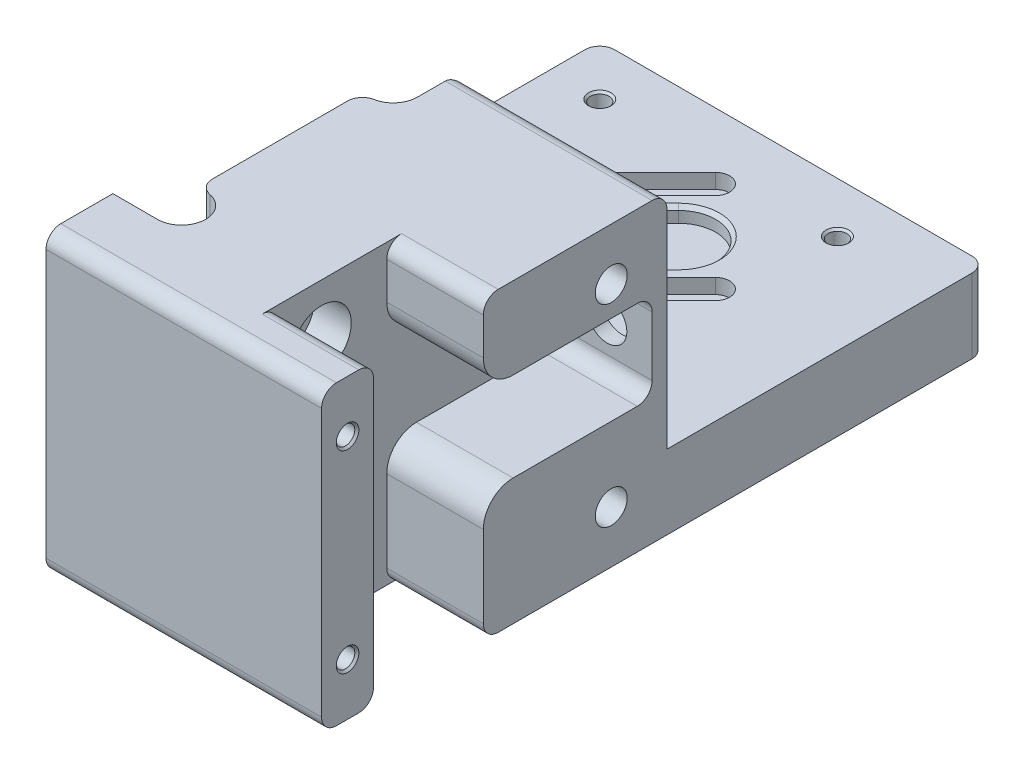
from build123d import *

# Parameters (mm, degrees)
SKETCH3_W                       = 13.49028586
SKETCH3_H                       = 10
BOSS_EXTRUDE1_DEPTH             = 22
SKETCH3_W_2                     = 3
BOSS_EXTRUDE1_2_DEPTH           = 22
BOSS_EXTRUDE1_3_DEPTH           = 22
SKETCH4_W                       = 27.150730292
SKETCH4_H                       = 10
BOSS_EXTRUDE2_DEPTH             = 3
SKETCH5_W                       = 27.150730292
SKETCH5_H                       = 10
BOSS_EXTRUDE3_DEPTH             = 3
SKETCH7_W                       = 13
SKETCH7_H                       = 14.78
BOSS_EXTRUDE4_DEPTH             = 10
BOSS_EXTRUDE5_DEPTH             = 10
SKETCH15_R                      = 1.915111108
CUT_EXTRUDE4_DEPTH              = 320.596652048
SKETCH18_W                      = 13
SKETCH18_H                      = 14.78
BOSS_EXTRUDE6_DEPTH             = 30
M4_CLEARANCE_HOLE1_D            = 4.3
CUT_EXTRUDE7_DEPTH              = 5
CUT_EXTRUDE6_DEPTH              = 2
M3X0_5_TAPPED_HOLE2_D           = 2.5
M3X0_5_TAPPED_HOLE2_CSINK_D     = 3.05
M3X0_5_TAPPED_HOLE2_CSINK_ANGLE = 90
SKETCH43_W                      = 32.1
SKETCH43_H                      = 30
BOSS_EXTRUDE9_DEPTH             = 2.5
SKETCH27_W                      = 22.72
SKETCH27_H                      = 12
CUT_EXTRUDE9_DEPTH              = 13
FILLET1_R                       = 2
FILLET2_R                       = 4
CBORE_FOR_M4_SHCS1_D            = 4.3
CBORE_FOR_M4_SHCS1_CBORE_D      = 8
CBORE_FOR_M4_SHCS1_CBORE_DEPTH  = 5
SKETCH31_W                      = 37.1
SKETCH31_H                      = 40
BOSS_EXTRUDE8_DEPTH             = 2
M3X0_5_TAPPED_HOLE3_D           = 2.5
M3X0_5_TAPPED_HOLE3_DEPTH       = 8.5
M3X0_5_TAPPED_HOLE3_CSINK_D     = 3.05
M3X0_5_TAPPED_HOLE3_CSINK_ANGLE = 90
M3X0_5_TAPPED_HOLE3_TIP         = 0.751075774
FILLET4_R                       = 2
CUT_EXTRUDE10_REACH             = 325.465
CUT_EXTRUDE12_DEPTH             = 10
FILLET5_R                       = 2
M5_CLEARANCE_HOLE1_D            = 5.3
M5_CLEARANCE_HOLE1_DEPTH        = 2
BOSS_EXTRUDE10_START            = -8
BOSS_EXTRUDE10_DEPTH            = 8
CHAMFER1_SIZE                   = 0.5


with BuildPart() as part:
    # Sketch3 → Boss-Extrude1 (new body)
    with BuildSketch(Plane(origin=(-188.9, 0, 188.9), x_dir=(0.7071067811865475, 0, 0.7071067811865477), z_dir=(-0.7071067811865477, 0, 0.7071067811865475))):
        with Locations((0, -11.606969024)):
            Rectangle(SKETCH3_W, SKETCH3_H)
    extrude(amount=-BOSS_EXTRUDE1_DEPTH)



with BuildPart() as body_2:
    # Sketch3 → Boss-Extrude1 2 (new body)
    with BuildSketch(Plane(origin=(-188.9, 0, 188.9), x_dir=(0.7071067811865475, 0, 0.7071067811865477), z_dir=(-0.7071067811865477, 0, 0.7071067811865475))):
        with Locations((12.075365146, -11.606969024)):
            Rectangle(SKETCH3_W_2, SKETCH3_H)
    extrude(amount=-BOSS_EXTRUDE1_2_DEPTH)


with BuildPart() as body_3:
    # Sketch3 → Boss-Extrude1 3 (new body)
    with BuildSketch(Plane(origin=(-188.9, 0, 188.9), x_dir=(0.7071067811865475, 0, 0.7071067811865477), z_dir=(-0.7071067811865477, 0, 0.7071067811865475))):
        with Locations((-12.075365146, -11.606969024)):
            Rectangle(SKETCH3_W_2, SKETCH3_H)
    extrude(amount=-BOSS_EXTRUDE1_3_DEPTH)


with BuildPart() as part_1:
    add(part.part)

    add(body_2.part)  # Boss-Extrude2 merges body 2

    add(body_3.part)  # Boss-Extrude2 merges body 3
    # Sketch4 → Boss-Extrude2 (add)
    with BuildSketch(Plane(origin=(-188.9, 0, 188.9), x_dir=(0.7071067811865472, 0, 0.7071067811865479), z_dir=(-0.7071067811865479, 0, 0.7071067811865472))):
        with Locations((0, -11.606969024)):
            Rectangle(SKETCH4_W, SKETCH4_H)
    extrude(amount=BOSS_EXTRUDE2_DEPTH)

    # Sketch5 → Boss-Extrude3 (add)
    with BuildSketch(Plane(origin=(-173.343650814, 0, 173.343650814), x_dir=(-0.7071067811865472, 0, -0.7071067811865479), z_dir=(0.7071067811865479, 0, -0.7071067811865472))):
        with Locations((0, -11.606969024)):
            Rectangle(SKETCH5_W, SKETCH5_H)
    extrude(amount=BOSS_EXTRUDE3_DEPTH)

    # Sketch7 → Boss-Extrude4 (add)
    with BuildSketch(Plane(origin=(0, -6.606969024, 0), x_dir=(1, 0, 0), z_dir=(0, 1, 0))):
        Polygon((-183.9, -238.9), (-188.9, -238.9), (-188.9, -245.9), (-146.8, -245.9), (-146.8, -161.623097719), (-180.821563222, -161.623097719), (-161.623097719, -180.821563222), (-181.422087592, -200.620553095), (-200.620553095, -181.422087592), (-200.620553095, -203.9), (-183.9, -203.9), align=None)
        with Locations((-158.3, -233.51)):
            Rectangle(SKETCH7_W, SKETCH7_H, mode=Mode.SUBTRACT)
    extrude(amount=-BOSS_EXTRUDE4_DEPTH)

    # Sketch13 → Boss-Extrude5 (add)
    with BuildSketch(Plane(origin=(0, -6.606969024, 0), x_dir=(1, 0, 0), z_dir=(0, 1, 0))):
        Polygon((-203.9, -203.9), (-200.620553095, -203.9), (-200.620553095, -181.422087592), (-180.821563222, -161.623097719), (-146.8, -161.623097719), (-146.8, -158.343650814), (-203.9, -158.343650814), align=None)
    extrude(amount=-BOSS_EXTRUDE5_DEPTH)

    # Sketch15 → Cut-Extrude4 (cut, through all)
    with BuildSketch(Plane(origin=(0, -6.606969024, 0), x_dir=(1, 0, 0), z_dir=(0, 1, 0))):
        with Locations((-179.467375171, -167.219926457)):
            Circle(SKETCH15_R)
        with Locations((-167.219926457, -179.467375171)):
            Circle(SKETCH15_R)
        with Locations((-195.023724357, -182.776275643)):
            Circle(SKETCH15_R)
        with Locations((-182.776275643, -195.023724357)):
            Circle(SKETCH15_R)
    extrude(amount=-CUT_EXTRUDE4_DEPTH, mode=Mode.SUBTRACT)

    # Sketch18 → Boss-Extrude6 (add)
    with BuildSketch(Plane(origin=(0, -6.606969024, 0), x_dir=(1, 0, 0), z_dir=(0, 1, 0))):
        Polygon((-183.9, -203.9), (-146.8, -203.9), (-146.8, -245.9), (-188.9, -245.9), (-188.9, -238.9), (-183.9, -238.9), align=None)
        with Locations((-158.3, -233.51)):
            Rectangle(SKETCH18_W, SKETCH18_H, mode=Mode.SUBTRACT)
    extrude(amount=BOSS_EXTRUDE6_DEPTH)

    # M4 Clearance Hole1 (through all)
    with Locations(Plane(origin=(-146.8, 0, 0), x_dir=(0, 0, -1), z_dir=(1, 0, 0))):
        with Locations((-208.9, 16.393030976), (-208.9, -9.606969024)):
            Hole(M4_CLEARANCE_HOLE1_D / 2)

    # Sketch22 → Cut-Extrude7 (cut)
    with BuildSketch(Plane(origin=(-146.8, 0, 0), x_dir=(0, 0, -1), z_dir=(1, 0, 0))):
        Polygon((-245.9, 23.393030976), (-245.9, -16.606969024), (-158.343650814, -16.606969024), (-158.343650814, -6.606969024), (-203.9, -6.606969024), (-203.9, 23.393030976), align=None)
    extrude(amount=-CUT_EXTRUDE7_DEPTH, mode=Mode.SUBTRACT)

    # Sketch17 → Cut-Extrude6 (cut)
    with BuildSketch(Plane(origin=(0, -6.606969024, 0), x_dir=(1, 0, 0), z_dir=(0, 1, 0))):
        with BuildLine():
            Line((-189.960660172, -182.88959236), (-179.354058454, -172.282990642))
            ThreePointArc((-179.354058454, -172.282990642), (-172.282990642, -172.282990642), (-172.282990642, -179.354058454))
            Line((-172.282990642, -179.354058454), (-182.88959236, -189.960660172))
            ThreePointArc((-182.88959236, -189.960660172), (-189.960660172, -189.960660172), (-189.960660172, -182.88959236))
        make_face()
    extrude(amount=-CUT_EXTRUDE6_DEPTH, mode=Mode.SUBTRACT)

    # M3x0.5 Tapped Hole2 (through all)
    with Locations(Plane(origin=(0, -6.606969024, 0), x_dir=(1, 0, 0), z_dir=(0, 1, 0))):
        with Locations((-197.121825407, -165.121825407), (-165.121825407, -197.121825407), (-197.121825407, -197.121825407), (-165.121825407, -165.121825407)):
            CounterSinkHole(M3X0_5_TAPPED_HOLE2_D / 2, M3X0_5_TAPPED_HOLE2_CSINK_D / 2, counter_sink_angle=M3X0_5_TAPPED_HOLE2_CSINK_ANGLE)

    # Sketch43 → Boss-Extrude9 (add)
    with BuildSketch(Plane(origin=(0, 0, 203.9), x_dir=(-1, 0, 0), z_dir=(0, 0, -1))):
        with Locations((167.85, 8.393030976)):
            Rectangle(SKETCH43_W, SKETCH43_H)
    extrude(amount=BOSS_EXTRUDE9_DEPTH)

    # Sketch27 → Cut-Extrude9 (cut)
    with BuildSketch(Plane(origin=(-151.8, 0, 0), x_dir=(0, 0, -1), z_dir=(1, 0, 0))):
        with Locations((-214.76, 6.393030976)):
            Rectangle(SKETCH27_W, SKETCH27_H)
    extrude(amount=-CUT_EXTRUDE9_DEPTH, mode=Mode.SUBTRACT)

    # Fillet1
    fillet1_edges = [part_1.edges().sort_by_distance(p)[0] for p in [
        (-158.3, 0.393030976, 203.4),
        (-158.3, 12.393030976, 203.4),
    ]]
    fillet(fillet1_edges, radius=FILLET1_R)

    # Fillet2
    fillet2_edges = [part_1.edges().sort_by_distance(p)[0] for p in [
        (-158.3, 12.393030976, 226.12),
        (-158.3, 0.393030976, 226.12),
    ]]
    fillet(fillet2_edges, radius=FILLET2_R)

    # CBORE for M4 SHCS1 (through all)
    with Locations(Plane(origin=(-164.8, 0, 0), x_dir=(0, 0, -1), z_dir=(1, 0, 0))):
        with Locations((-234.9, 16.393030976), (-234.9, -9.606969024)):
            CounterBoreHole(CBORE_FOR_M4_SHCS1_D / 2, CBORE_FOR_M4_SHCS1_CBORE_D / 2, CBORE_FOR_M4_SHCS1_CBORE_DEPTH)

    # Sketch31 → Boss-Extrude8 (add)
    with BuildSketch(Plane.XY.offset(245.9)):
        with Locations((-170.35, 3.393030976)):
            Rectangle(SKETCH31_W, SKETCH31_H)
    extrude(amount=BOSS_EXTRUDE8_DEPTH)

    # M3x0.5 Tapped Hole3
    with Locations(Plane(origin=(-151.8, 0, 0), x_dir=(0, 0, -1), z_dir=(1, 0, 0))):
        with Locations((-244.4, 16.393030976), (-244.4, -9.606969024)):
            CounterSinkHole(M3X0_5_TAPPED_HOLE3_D / 2, M3X0_5_TAPPED_HOLE3_CSINK_D / 2, depth=M3X0_5_TAPPED_HOLE3_DEPTH, counter_sink_angle=M3X0_5_TAPPED_HOLE3_CSINK_ANGLE)
            with Locations((0, 0, -(M3X0_5_TAPPED_HOLE3_DEPTH + M3X0_5_TAPPED_HOLE3_TIP / 2))):  # 118° drill point
                Cone(0, M3X0_5_TAPPED_HOLE3_D / 2, M3X0_5_TAPPED_HOLE3_TIP, mode=Mode.SUBTRACT)

    # Fillet4
    fillet4_edges = [part_1.edges().sort_by_distance(p)[0] for p in [
        (-158.3, -16.606969024, 226.12),
        (-203.9, -11.606969024, 203.9),
        (-203.9, -11.606969024, 158.343650814),
        (-158.3, 23.393030976, 226.12),
        (-158.3, 23.393030976, 240.9),
        (-151.8, -11.606969024, 158.343650814),
        (-167.85, 23.393030976, 201.4),
        (-170.35, -16.606969024, 247.9),
        (-170.35, 23.393030976, 247.9),
        (-158.3, -16.606969024, 240.9),
    ]]
    fillet(fillet4_edges, radius=FILLET4_R)

    # Cut-Extrude10: up to this face of the body (flat: up to its plane)
    cut_extrude10_end = Plane(part_1.part.faces().sort_by_distance((-177.85, -6.606969024, 159.03573397))[0])
    # Sketch36 → Cut-Extrude10 (cut, up to the picked face)
    with BuildSketch(Plane(origin=(0, 23.393030976, 0), x_dir=(1, 0, 0), z_dir=(0, 1, 0)), mode=Mode.PRIVATE) as cut_extrude10_sk1:
        with BuildLine():
            Line((-182.9, -232.4), (-183.9, -232.4))
            Line((-183.9, -232.4), (-183.9, -238.9))
            Line((-183.9, -238.9), (-182.9, -238.9))
            ThreePointArc((-182.9, -238.9), (-179.65, -235.65), (-182.9, -232.4))
        make_face()
    cut_extrude10_tool1 = split(extrude(cut_extrude10_sk1.sketch, amount=-CUT_EXTRUDE10_REACH, mode=Mode.PRIVATE), bisect_by=cut_extrude10_end, keep=Keep.BOTH, mode=Mode.PRIVATE)
    # Sketch36 → Cut-Extrude10 (cut, up to the picked face)
    with BuildSketch(Plane(origin=(0, 23.393030976, 0), x_dir=(1, 0, 0), z_dir=(0, 1, 0)), mode=Mode.PRIVATE) as cut_extrude10_sk2:
        with BuildLine():
            Line((-183.9, -210.4), (-183.9, -201.4))
            Line((-183.9, -201.4), (-177.65, -201.4))
            ThreePointArc((-177.65, -201.4), (-179.064213562, -201.985786438), (-179.65, -203.4))
            Line((-179.65, -203.4), (-179.65, -207.15))
            ThreePointArc((-179.65, -207.15), (-180.601902961, -209.448097039), (-182.9, -210.4))
            Line((-182.9, -210.4), (-183.9, -210.4))
        make_face()
    cut_extrude10_tool2 = split(extrude(cut_extrude10_sk2.sketch, amount=-CUT_EXTRUDE10_REACH, mode=Mode.PRIVATE), bisect_by=cut_extrude10_end, keep=Keep.BOTH, mode=Mode.PRIVATE)
    add(cut_extrude10_tool1.solids().sort_by(Axis((-182.04967, 23.393031, 235.65), (0, -1, 0)))[0], mode=Mode.SUBTRACT)
    add(cut_extrude10_tool2.solids().sort_by(Axis((-181.801157, 23.393031, 205.573356), (0, -1, 0)))[0], mode=Mode.SUBTRACT)

    # Sketch44 → Cut-Extrude12 (cut)
    with BuildSketch(Plane(origin=(0, -6.606969024, 0), x_dir=(1, 0, 0), z_dir=(0, 1, 0))):
        with BuildLine():
            Line((-183.9, -210.4), (-182.9, -210.4))
            ThreePointArc((-182.9, -210.4), (-179.65, -207.15), (-182.9, -203.9))
            Line((-182.9, -203.9), (-183.9, -203.9))
            Line((-183.9, -203.9), (-183.9, -210.4))
        make_face()
        with BuildLine():
            Line((-182.9, -232.4), (-183.9, -232.4))
            Line((-183.9, -232.4), (-183.9, -238.9))
            Line((-183.9, -238.9), (-182.9, -238.9))
            ThreePointArc((-182.9, -238.9), (-179.65, -235.65), (-182.9, -232.4))
        make_face()
    extrude(amount=-CUT_EXTRUDE12_DEPTH, mode=Mode.SUBTRACT)

    # Fillet5
    # the kernel refuses this fillet: 2 mm, written as the material it takes off along each edge
    with BuildSketch(Plane(origin=(-183.9, 34.816323168, 232.4), x_dir=(0, 0, -1), z_dir=(0, -1, 0))) as fillet5_piece_1:
        with BuildLine():
            CenterArc((1.903882032, 2), FILLET5_R, 190.980575428, 79.019424572)
            Line((-0.059501599, 1.619047619), (-0.255839962, 1.580952381))
            ThreePointArc((-0.255839962, 1.580952381), (-0.2, 1), (-0.2, 0))
            Line((-0.2, 0), (0, -0.2))
            Line((0, -0.2), (1.903882032, -0.2))
            Line((1.903882032, -0.2), (1.903882032, 0))
        make_face()
    extrude(amount=62.846584384, mode=Mode.SUBTRACT)
    with BuildSketch(Plane(origin=(-183.9, 26.276030988, 210.4), x_dir=(0.9993253657611183, 0, -0.03672619428156218), z_dir=(0, -1, 0))) as fillet5_piece_2:
        with BuildLine():
            CenterArc((1.92872839, 1.976049997), FILLET5_R, 182.104729259, 79.019424572)
            Line((-0.069922341, 1.902597608), (-0.269787415, 1.895252369))
            Line((-0.269787415, 1.895252369), (-0.199865073, -0.007345239))
            Line((-0.199865073, -0.007345239), (0.007345239, -0.199865073))
            ThreePointArc((0.007345239, -0.199865073), (1.006670605, -0.163138879), (1.589281845, -0.197605))
            Line((1.589281845, -0.197605), (1.620140621, 0))
        make_face()
    extrude(amount=45.766000024, mode=Mode.SUBTRACT)

    # M5 Clearance Hole1
    with Locations(Plane(origin=(0, 0, 201.4), x_dir=(-1, 0, 0), z_dir=(0, 0, -1))):
        with Locations((157.85, 6.393030976)):
            Hole(M5_CLEARANCE_HOLE1_D / 2, depth=M5_CLEARANCE_HOLE1_DEPTH)

    # Sketch45 → Boss-Extrude10 (add)
    with BuildSketch(Plane.XZ.offset(16.606969024).offset(BOSS_EXTRUDE10_START)):
        with BuildLine():
            Line((-165.865738406, 180.821563222), (-181.422087592, 196.377912408))
            ThreePointArc((-181.422087592, 196.377912408), (-184.130463694, 196.377912408), (-184.130463694, 193.669536306))
            Line((-184.130463694, 193.669536306), (-168.574114508, 178.11318712))
            ThreePointArc((-168.574114508, 178.11318712), (-165.865738406, 178.11318712), (-165.865738406, 180.821563222))
        make_face()
        with BuildLine():
            Line((-180.821563222, 165.865738406), (-196.377912408, 181.422087592))
            ThreePointArc((-196.377912408, 181.422087592), (-196.377912408, 184.130463694), (-193.669536306, 184.130463694))
            Line((-193.669536306, 184.130463694), (-178.11318712, 168.574114508))
            ThreePointArc((-178.11318712, 168.574114508), (-178.11318712, 165.865738406), (-180.821563222, 165.865738406))
        make_face()
    extrude(amount=BOSS_EXTRUDE10_DEPTH)

    # Chamfer1
    chamfer1_edges = [part_1.edges().sort_by_distance(p)[0] for p in [
        (-189.960660172, -6.606969024, 189.960660172),
        (-177.586291501, -6.606969024, 184.657359313),
        (-172.282990642, -6.606969024, 172.282990642),
        (-184.657359313, -6.606969024, 177.586291501),
    ]]
    chamfer(chamfer1_edges, length=CHAMFER1_SIZE)


solid = part_1.part
